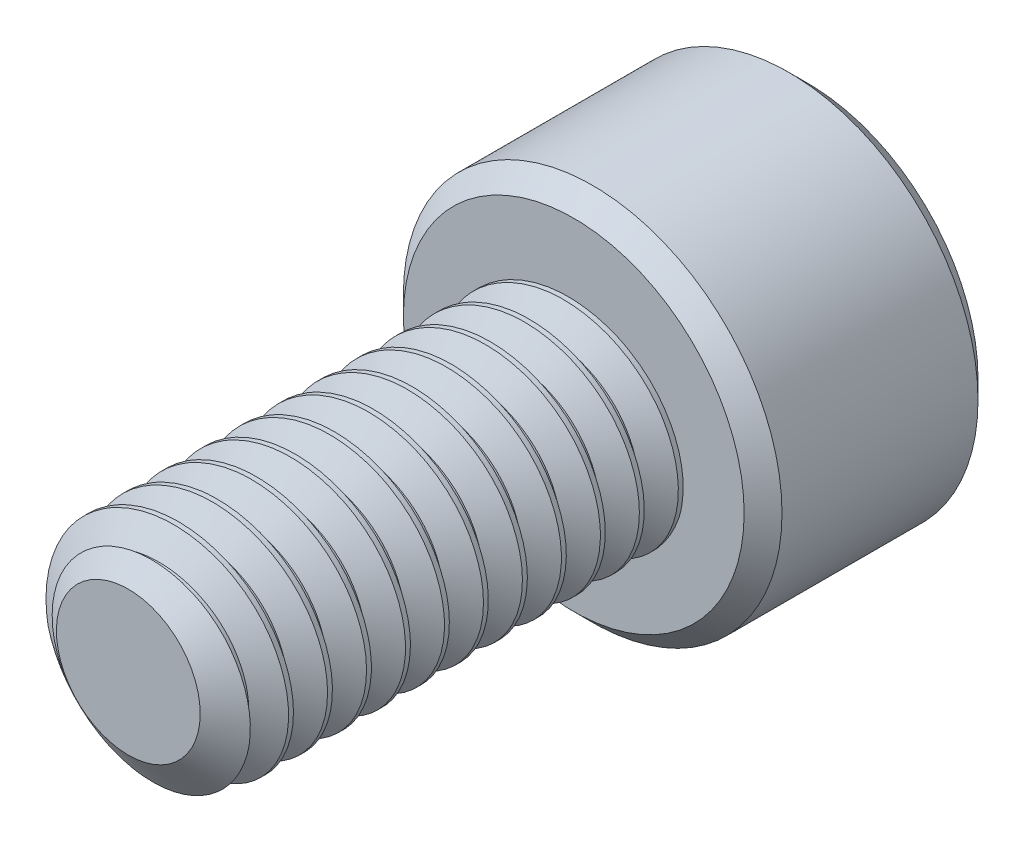
from build123d import *

# Parameters (mm, degrees)
SKETCH1_R          = 2
EXTRUDE1_DEPTH     = 8
CUT_SWEEP1_PITCH   = 0.7
SKETCH6_R          = 3.4
EXTRUDE2_DEPTH     = 4.2
CUT_EXTRUDE1_DEPTH = 2.67890625
CHAMFER1_SIZE      = 0.34


with BuildPart() as part:
    # Sketch1 → Extrude1 (new body)
    with BuildSketch(Plane.XY):
        Circle(SKETCH1_R)
    extrude(amount=-EXTRUDE1_DEPTH)

    # Cut-Sweep1: the profile of Sketch3 profile screwed along a right-hand helix of 12.428571 turns, 6 arcs to a turn; built about Z, then put on its axis
    cut_sweep1_z = Axis((0, 0, 0), (0, 0, 1))
    cut_sweep1_corners = [(2.0003, 0, -0.612673205), (1.545336663, 0, -0.35), (1.545336663, 0, -0.2625), (2.0003, 0, 0.000173205)]
    with BuildLine(mode=Mode.PRIVATE) as cut_sweep1_profile:
        Line(cut_sweep1_corners[0], cut_sweep1_corners[1])
        Line(cut_sweep1_corners[1], cut_sweep1_corners[2])
        Line(cut_sweep1_corners[2], cut_sweep1_corners[3])
        Line(cut_sweep1_corners[3], cut_sweep1_corners[0])
    cut_sweep1_cap = Face(cut_sweep1_profile.wire())
    cut_sweep1_turn_angles = [0, 30, 60, 90, 120, 150, 180, 210, 240, 270, 300, 330, 360]
    cut_sweep1_turn_weights = [1, 0.8660254037844387, 1, 0.8660254037844387, 1, 0.8660254037844387, 1, 0.8660254037844387, 1, 0.8660254037844387, 1, 0.8660254037844387, 1]
    cut_sweep1_turn_rails = [Edge.make_bspline([Vector(p[0], p[1], 0).rotate(cut_sweep1_z, cut_sweep1_turn_angles[k]) / cut_sweep1_turn_weights[k] + Vector(0, 0, p[2] + CUT_SWEEP1_PITCH * cut_sweep1_turn_angles[k] / 360) for k in range(13)], [0, 0, 0, 1, 1, 2, 2, 3, 3, 4, 4, 5, 5, 6, 6, 6], 2, cut_sweep1_turn_weights) for p in cut_sweep1_corners]
    cut_sweep1_turn_sides = [Face.make_surface_from_curves(cut_sweep1_turn_rails[p[0]], cut_sweep1_turn_rails[p[1]]) for p in [(0, 1), (1, 2), (2, 3), (3, 0)]]
    cut_sweep1_last_angles = [4320, 4350, 4380, 4410, 4440, 4457.142857143, 4474.285714286]
    cut_sweep1_last_weights = [1, 0.8660254037844387, 1, 0.8660254037844387, 1, 0.9555728057861561, 1]
    cut_sweep1_last_rails = [Edge.make_bspline([Vector(p[0], p[1], 0).rotate(cut_sweep1_z, cut_sweep1_last_angles[k]) / cut_sweep1_last_weights[k] + Vector(0, 0, p[2] + CUT_SWEEP1_PITCH * cut_sweep1_last_angles[k] / 360) for k in range(7)], [0, 0, 0, 1, 1, 2, 2, 3, 3, 3], 2, cut_sweep1_last_weights) for p in cut_sweep1_corners]
    cut_sweep1_last_sides = [Face.make_surface_from_curves(cut_sweep1_last_rails[p[0]], cut_sweep1_last_rails[p[1]]) for p in [(0, 1), (1, 2), (2, 3), (3, 0)]]
    cut_sweep1 = Plane(origin=(0, 0, 0), x_dir=(0, 1, 0), z_dir=(0, 0, -1)) * Solid(Shell([*[p.moved(Location((0, 0, CUT_SWEEP1_PITCH * i))) for i in range(12) for p in cut_sweep1_turn_sides], *cut_sweep1_last_sides, cut_sweep1_cap, cut_sweep1_cap.rotate(cut_sweep1_z, 4474.285714286).moved(Location((0, 0, CUT_SWEEP1_PITCH * 4474.285714286 / 360)))]))
    add(cut_sweep1, mode=Mode.SUBTRACT)

    # Sketch4 → Cut-Revolve1 (revolve, cut)
    with BuildSketch(Plane(origin=(0, 0, 0), x_dir=(0, 0, -1), z_dir=(1, 0, 0)), mode=Mode.PRIVATE) as cut_revolve1_sk:
        Polygon((0.496211411, 2), (0, 1.291336663), (0, 2), align=None)
    revolve(cut_revolve1_sk.sketch.rotate(Axis((0, 0, 0), (0, 0, -1)), 271.401126896), axis=Axis((0, 0, 0), (0, 0, -1)), mode=Mode.SUBTRACT)

    # Sketch6 → Extrude2 (add)
    with BuildSketch(Plane(origin=(0, 0, -8), x_dir=(-1, 0, 0), z_dir=(0, 0, -1))):
        Circle(SKETCH6_R)
    extrude(amount=EXTRUDE2_DEPTH)

    # Sketch7 → Cut-Extrude1 (cut)
    with BuildSketch(Plane(origin=(0, 0, -12.2), x_dir=(-1, 0, 0), z_dir=(0, 0, -1))):
        Polygon((0, 2.062222993), (-1.7859375, 1.031111496), (-1.7859375, -1.031111496), (0, -2.062222993), (1.7859375, -1.031111496), (1.7859375, 1.031111496), align=None)
    extrude(amount=-CUT_EXTRUDE1_DEPTH, mode=Mode.SUBTRACT)

    # Cut-Extrude2 cone 1 section (through the dimple's axis) → Cut-Extrude2 (revolve, cut)
    with BuildSketch(Plane(origin=(0, 0, -12.2), x_dir=(0, 1, 0), z_dir=(1, 0, 0))):
        Polygon((0, 0), (2.062222993, 0), (0, 2.062222993), align=None)
    revolve(axis=Axis((0, 0, -12.2), (0, 0, 1)), mode=Mode.SUBTRACT)

    # Chamfer1
    chamfer1_edges = [part.edges().sort_by_distance(p)[0] for p in [
        (3.4, 0, -8),
        (3.4, 0, -12.2),
    ]]
    chamfer(chamfer1_edges, length=CHAMFER1_SIZE)


solid = part.part
